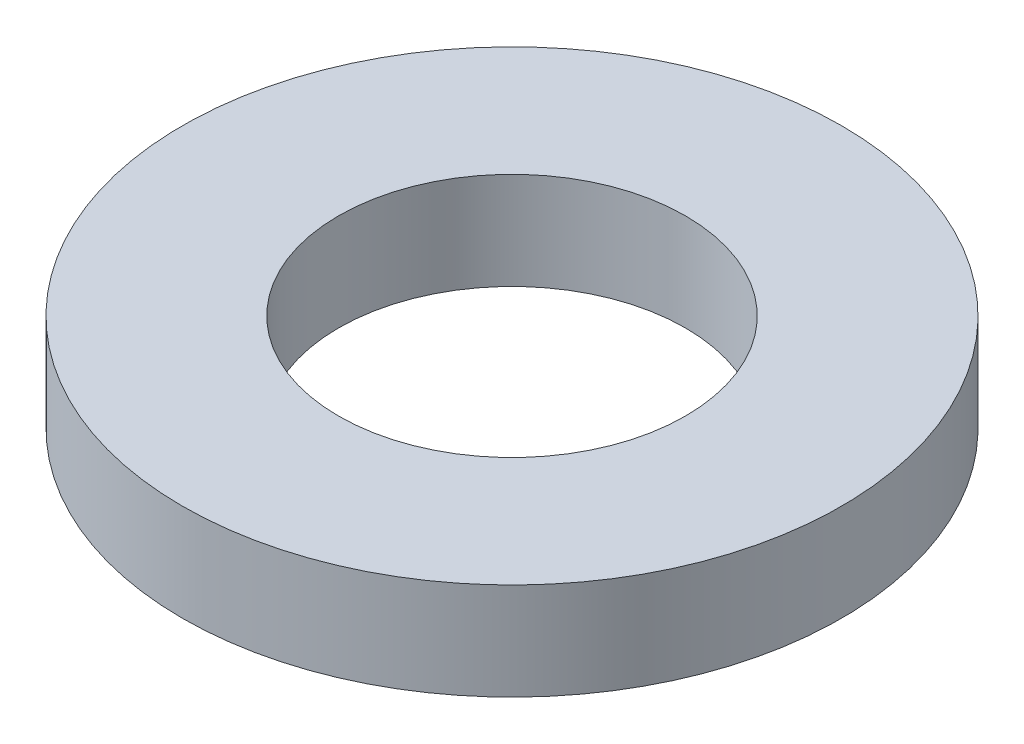
from build123d import *

# Parameters (mm, degrees)
SKETCH1_R           = 47.5
BOSS_EXTRUDE1_DEPTH = 14
SKETCH2_R           = 25
CUT_EXTRUDE1_DEPTH  = 69.618510622


with BuildPart() as part:
    # Sketch1 → Boss-Extrude1 (new body)
    with BuildSketch(Plane(origin=(0, 0, 0), x_dir=(1, 0, 0), z_dir=(0, 1, 0))):
        Circle(SKETCH1_R)
    extrude(amount=BOSS_EXTRUDE1_DEPTH)

    # Sketch2 → Cut-Extrude1 (cut, through all)
    with BuildSketch(Plane(origin=(0, 0, 0), x_dir=(1, 0, 0), z_dir=(0, 1, 0))):
        Circle(SKETCH2_R)
    extrude(amount=CUT_EXTRUDE1_DEPTH, mode=Mode.SUBTRACT)


solid = part.part
